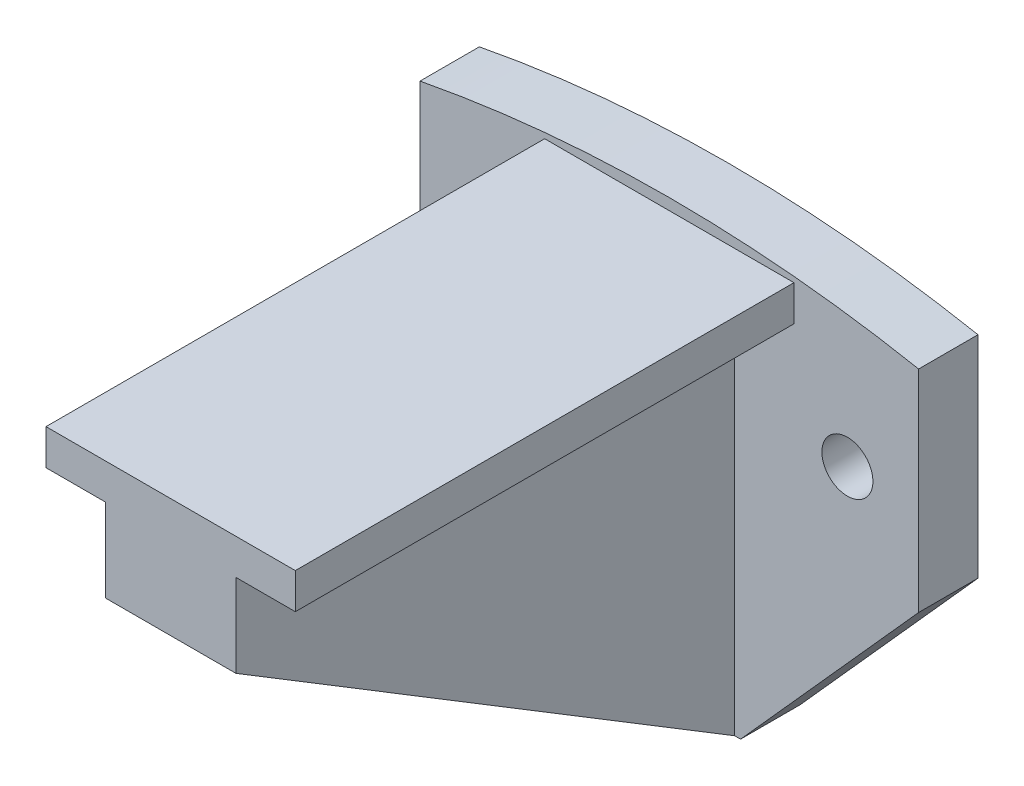
from build123d import *

# Parameters (mm, degrees)
BOSS_EXTRUDE1_DEPTH      = 42
BOSS_EXTRUDE3_DEPTH      = 5
SKETCH5_R                = 2.15
CUT_EXTRUDE4_DEPTH       = 5
BOSS_EXTRUDE4_DEPTH      = 8
BOSS_EXTRUDE4_DEPTH_BACK = 8
ENL_V_START              = -42
ESQUISSE2_W              = 18.319626144
ESQUISSE2_H              = 0.2
ENL_V_MAT_EXTRU_1_DEPTH  = 42
ESQUISSE4_W              = 42
ESQUISSE4_H              = 5
BOSS_EXTRU_2_DEPTH       = 15
ESQUISSE5_R              = 2.15
ENL_V_MAT_EXTRU_2_DEPTH  = 28
ENL_V_START_2            = -5
ENL_V_MAT_EXTRU_3_DEPTH  = 5
BOSS_EXTRU_3_DEPTH       = 5.8
BOSS_EXTRU_4_DEPTH       = 15
ESQUISSE14_W             = 44.082286315
ESQUISSE14_H             = 62.535336401
ENL_V_MAT_EXTRU_4_DEPTH  = 50
BOSS_EXTRU_5_DEPTH       = 42
BOSS_EXTRU_7_DEPTH       = 11
ESQUISSE20_R             = 2.15
ENL_V_MAT_EXTRU_7_DEPTH  = 42
BOSS_EXTRU_8_START       = -5
BOSS_EXTRU_8_DEPTH       = 5


# Read off the part's stored shape, not the designer's step: Enlèv. mat.-Extru.3
with BuildPart() as part:
    # Sketch1 → Boss-Extrude1 (new body)
    with BuildSketch(Plane.XY):
        Polygon((-8.8, 3), (-6.002154051, -3), (6.002154051, -3), (8.8, 3), align=None)
    extrude(amount=BOSS_EXTRUDE1_DEPTH)

    # Sketch2 → Boss-Extrude3 (add)
    with BuildSketch(Plane(origin=(0, 0, 0), x_dir=(-1, 0, 0), z_dir=(0, 0, -1))):
        with BuildLine():
            Line((21, 4.736174234), (21, -13.75))
            Line((21, -13.75), (-21, -13.75))
            Line((-21, -13.75), (-21, 4.736174234))
            ThreePointArc((-21, 4.736174234), (0, 6.759324864), (21, 4.736174234))
        make_face()
    extrude(amount=BOSS_EXTRUDE3_DEPTH)

    # Sketch5 → Cut-Extrude4 (cut)
    with BuildSketch(Plane(origin=(0, 0, -5), x_dir=(-1, 0, 0), z_dir=(0, 0, -1))):
        with Locations((-15, -4.37207547)):
            Circle(SKETCH5_R)
        with Locations((15, -4.37207547)):
            Circle(SKETCH5_R)
    extrude(amount=-CUT_EXTRUDE4_DEPTH, mode=Mode.SUBTRACT)

    # Sketch4 → Boss-Extrude4 (add, two sides: drawn at the far end of the back side and taken through both)
    with BuildSketch(Plane.ZY.offset(-BOSS_EXTRUDE4_DEPTH_BACK)):
        Polygon((42, -3), (0, -3), (0, -26), (15, -26), (15, -17.785714286), align=None)
    extrude(amount=BOSS_EXTRUDE4_DEPTH + BOSS_EXTRUDE4_DEPTH_BACK)

    # Esquisse2 → Enlèv. mat.-Extru.1 (cut)
    with BuildSketch(Plane.XY.offset(42).offset(ENL_V_START)):
        with Locations((-0.359813072, 2.9)):
            Rectangle(ESQUISSE2_W, ESQUISSE2_H)
    extrude(amount=ENL_V_MAT_EXTRU_1_DEPTH, mode=Mode.SUBTRACT)

    # Esquisse4 → Boss.-Extru.2 (add)
    with BuildSketch(Plane.XZ.offset(13.75)):
        with Locations((0, -2.5)):
            Rectangle(ESQUISSE4_W, ESQUISSE4_H)
    extrude(amount=BOSS_EXTRU_2_DEPTH)

    # Esquisse5 → Enlèv. mat.-Extru.2 (cut)
    with BuildSketch(Plane(origin=(0, 0, -5), x_dir=(-1, 0, 0), z_dir=(0, 0, -1))):
        with Locations((0, -23.240675136)):
            Circle(ESQUISSE5_R)
    extrude(amount=-ENL_V_MAT_EXTRU_2_DEPTH, mode=Mode.SUBTRACT)

    # Enlèv. mat.-Extru.3 outline → Enlèv. mat.-Extru.3 (cut)
    with BuildSketch(Plane(origin=(0, 0, -5), x_dir=(-1, 0, 0), z_dir=(0, 0, -1)).offset(ENL_V_START_2)):
        Polygon((21, -12.006912883), (6, -28.75), (21, -28.75), align=None)
        Polygon((-6, -28.75), (-21, -12.006912883), (-21, -28.75), align=None)
    extrude(amount=ENL_V_MAT_EXTRU_3_DEPTH, mode=Mode.SUBTRACT)

    # Esquisse7 → Boss.-Extru.3 (add)
    with BuildSketch(Plane(origin=(0, 2.8, 0), x_dir=(1, 0, 0), z_dir=(0, 1, 0))):
        with BuildLine():
            Line((2.5, -42), (0, -42))
            Line((0, -42), (-2.5, -42))
            Line((-2.5, -42), (-2.5, -42.178964355))
            ThreePointArc((-2.5, -42.178964355), (0, -47.633030278), (2.5, -42.178964355))
            Line((2.5, -42.178964355), (2.5, -42))
        make_face()
    extrude(amount=-BOSS_EXTRU_3_DEPTH)

    # Esquisse9 → Boss.-Extru.4 (add)
    with BuildSketch(Plane.XY):
        Polygon((8, -26), (8, -26.146615259), (6, -28.75), (-6, -28.75), (-8, -26.360097245), (-8, -26), align=None)
    extrude(amount=BOSS_EXTRU_4_DEPTH)

    # Esquisse14 → Enlèv. mat.-Extru.4 (cut)
    with BuildSketch(Plane.XY):
        with Locations((2.134773814, -3.901083115)):
            Rectangle(ESQUISSE14_W, ESQUISSE14_H)
    extrude(amount=ENL_V_MAT_EXTRU_4_DEPTH, mode=Mode.SUBTRACT)

    # Esquisse15 → Boss.-Extru.5 (add)
    with BuildSketch(Plane.XY):
        Polygon((-10.5, 6.8), (10.5, 6.8), (10.5, 3.8), (5.5, 3.8), (5.5, -3.2), (-5.5, -3.2), (-5.5, 3.8), (-10.5, 3.8), align=None)
    extrude(amount=BOSS_EXTRU_5_DEPTH)

    # Esquisse16 → Boss.-Extru.7 (add)
    with BuildSketch(Plane(origin=(5.5, 0, 0), x_dir=(0, 0, -1), z_dir=(1, 0, 0))):
        Polygon((0, -3.2), (0, -28.75), (-42, -3.2), align=None)
    extrude(amount=-BOSS_EXTRU_7_DEPTH)

    # Esquisse20 → Enlèv. mat.-Extru.7 (cut)
    with BuildSketch(Plane(origin=(0, 0, 0), x_dir=(-1, 0, 0), z_dir=(0, 0, -1))):
        with Locations((0, -23.240675136)):
            Circle(ESQUISSE20_R)
    extrude(amount=-ENL_V_MAT_EXTRU_7_DEPTH, mode=Mode.SUBTRACT)

    # Esquisse21 → Boss.-Extru.8 (add)
    with BuildSketch(Plane(origin=(0, 0, -5), x_dir=(-1, 0, 0), z_dir=(0, 0, -1)).offset(BOSS_EXTRU_8_START)):
        with BuildLine():
            Line((-21, 4.736174234), (-21, 5.754737611))
            ThreePointArc((-21, 5.754737611), (0, 7.759324864), (21, 5.754737611))
            Line((21, 5.754737611), (21, 4.736174234))
            ThreePointArc((21, 4.736174234), (0, 6.759324864), (-21, 4.736174234))
        make_face()
    extrude(amount=BOSS_EXTRU_8_DEPTH)


solid = part.part
